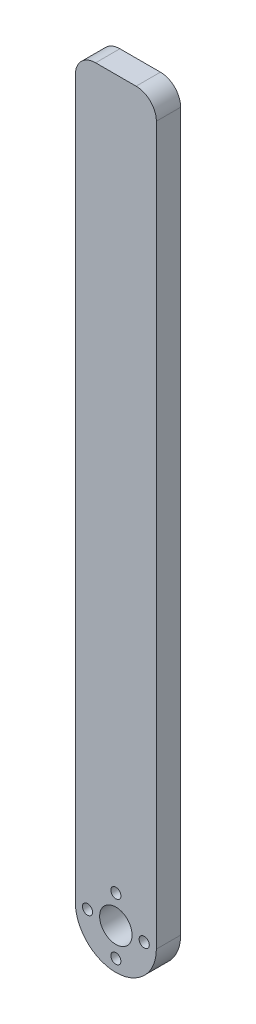
from build123d import *

# Parameters (mm, degrees)
ESQUISSE1_W                  = 20
ESQUISSE1_H                  = 192
BOSS_EXTRU_1_DEPTH           = 6
ENL_V_MAT_EXTRU_1_DEPTH      = 194.132079158
ENL_V_MAT_EXTRU_1_DEPTH_BACK = 194.132079158
ESQUISSE2_R                  = 4
CONG_1_R                     = 10
CONG_2_R                     = 5
ENL_V_MAT_EXTRU_2_DEPTH      = 194.132079158
ENL_V_MAT_EXTRU_2_DEPTH_BACK = 194.132079158
ESQUISSE3_R                  = 1.25


with BuildPart() as part:
    # Esquisse1 → Boss.-Extru.1 (new body)
    with BuildSketch(Plane.XY):
        with Locations((10, 96)):
            Rectangle(ESQUISSE1_W, ESQUISSE1_H)
    extrude(amount=BOSS_EXTRU_1_DEPTH)

    # Esquisse2 → Enlèv. mat.-Extru.1 (cut, two sides: drawn at the far end of the back side and taken through both)
    with BuildSketch(Plane.XY.offset(6).offset(-ENL_V_MAT_EXTRU_1_DEPTH_BACK)):
        with Locations((10, 10)):
            Circle(ESQUISSE2_R)
    extrude(amount=ENL_V_MAT_EXTRU_1_DEPTH + ENL_V_MAT_EXTRU_1_DEPTH_BACK, mode=Mode.SUBTRACT)

    # Congé1
    cong_1_edges = [part.edges().sort_by_distance(p)[0] for p in [
        (20, 0, 3),
        (0, 0, 3),
    ]]
    fillet(cong_1_edges, radius=CONG_1_R - 0.0001)  # a hair under: the kernel refuses the full size

    # Congé2
    cong_2_edges = [part.edges().sort_by_distance(p)[0] for p in [
        (0, 192, 3),
        (20, 192, 3),
    ]]
    fillet(cong_2_edges, radius=CONG_2_R)

    # Esquisse3 → Enlèv. mat.-Extru.2 (cut, two sides: drawn at the far end of the back side and taken through both)
    with BuildSketch(Plane.XY.offset(6).offset(-ENL_V_MAT_EXTRU_2_DEPTH_BACK)):
        with Locations((10, 17)):
            Circle(ESQUISSE3_R)
        with Locations((17, 10)):
            Circle(ESQUISSE3_R)
        with Locations((10, 3)):
            Circle(ESQUISSE3_R)
        with Locations((3, 10)):
            Circle(ESQUISSE3_R)
    extrude(amount=ENL_V_MAT_EXTRU_2_DEPTH + ENL_V_MAT_EXTRU_2_DEPTH_BACK, mode=Mode.SUBTRACT)


solid = part.part
